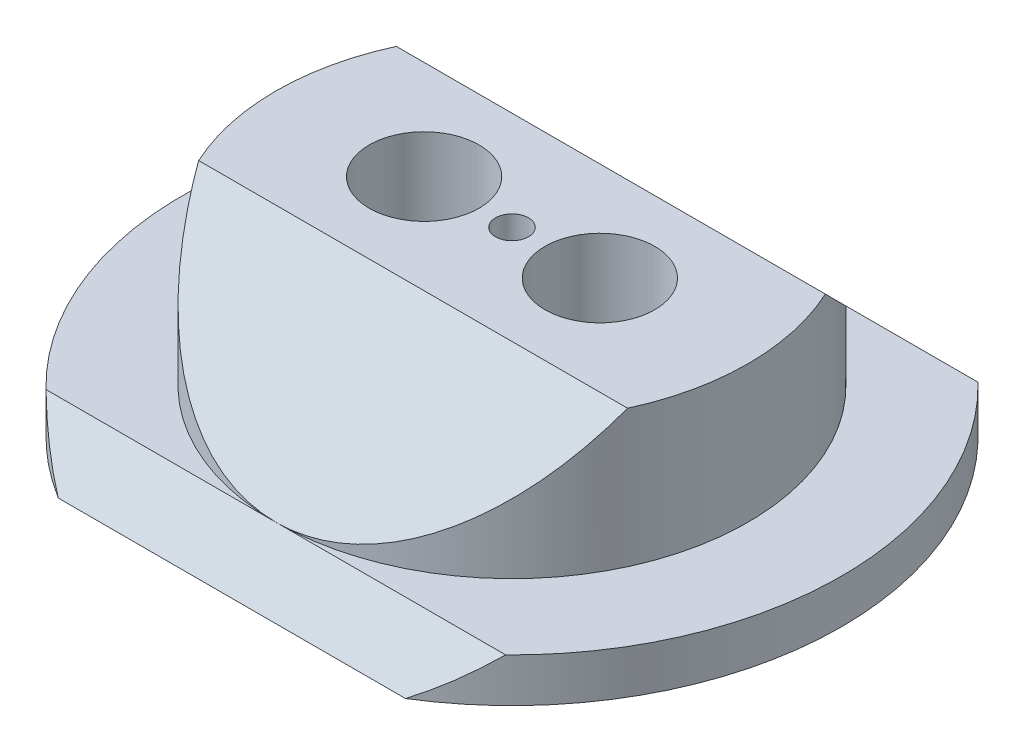
from build123d import *
from build123d.topology import SkipClean

# Parameters (mm, degrees)
SKETCH1_R                            = 30
BOSS_EXTRUDE1_DEPTH                  = 4
BOSS_EXTRUDE2_REACH                  = 44.615
BOSS_EXTRUDE2_END_RADIUS             = 30
BOSS_EXTRUDE2_DIRECTION_2_REACH      = 44.615
BOSS_EXTRUDE2_DIRECTION_2_END_RADIUS = 30
SKETCH3_OUTSIDE_W                    = 78.092
SKETCH3_OUTSIDE_H                    = 69.092
SKETCH3_OUTSIDE_R                    = 21.5
CUT_EXTRUDE2_DEPTH                   = 12.5
BOSS_EXTRUDE3_DEPTH                  = 18
BOSS_EXTRUDE4_DEPTH                  = 15
BOSS_EXTRUDE5_DEPTH                  = 15
CUT_EXTRUDE3_DEPTH                   = 44.292609069
CUT_EXTRUDE3_DEPTH_BACK              = 44.292609069
SKETCH8_R                            = 2
CUT_EXTRUDE8_DEPTH                   = 48.077064479
CUT_EXTRUDE8_DEPTH_BACK              = 48.077064479
CUT_EXTRUDE9_DEPTH                   = 59.659818207
CUT_EXTRUDE11_DEPTH                  = 20
CUT_EXTRUDE12_DEPTH                  = 20
CUT_EXTRUDE13_DEPTH                  = 20
CUT_EXTRUDE14_DEPTH                  = 44.292609069
CUT_EXTRUDE14_DEPTH_BACK             = 44.292609069
SKETCH25_W                           = 66.075437062
SKETCH25_H                           = 20.142243048
SKETCH26_R                           = 5
CUT_EXTRUDE15_DEPTH                  = 24
SKETCH27_R                           = 1.5
CUT_EXTRUDE16_DEPTH                  = 30
SKETCH28_R                           = 5
CUT_EXTRUDE17_DEPTH                  = 3


with BuildPart() as part:
    # Sketch1 → Boss-Extrude1 (new body)
    with BuildSketch(Plane(origin=(0, 0, 0), x_dir=(1, 0, 0), z_dir=(0, 1, 0))):
        with Locations(Location((0, 0, 0), (0, 0, 270))):
            Circle(SKETCH1_R)
    extrude(amount=BOSS_EXTRUDE1_DEPTH)

    # Boss-Extrude2: up to this cylinder (the profile starts inside it)
    with SkipClean():  # the faces are left unmerged after this step: merging them gives an invalid solid
        boss_extrude2_end = Plane(origin=(0, 9.396175, 0), z_dir=(0, -1, 0)) * Cylinder(BOSS_EXTRUDE2_END_RADIUS, 150.23, mode=Mode.PRIVATE)
        # Sketch2 → Boss-Extrude2 (add, up to the surface)
        with BuildSketch(Plane(origin=(0, 0, 0), x_dir=(0, 0, -1), z_dir=(1, 0, 0)), mode=Mode.PRIVATE) as boss_extrude2_sk1:
            Polygon((0, 4), (21.5, 4), (9, 16.5), (-9, 16.5), (-21.5, 4), align=None)
        boss_extrude2_tool1 = extrude(boss_extrude2_sk1.sketch, amount=BOSS_EXTRUDE2_REACH, mode=Mode.PRIVATE) & boss_extrude2_end
        add(boss_extrude2_tool1.solids().sort_by_distance((0, 9.396175, 0))[0])

    # Boss-Extrude2 direction 2: up to this cylinder (the profile starts inside it)
    with SkipClean():  # the faces are left unmerged after this step: merging them gives an invalid solid
        boss_extrude2_direction_2_end = Plane(origin=(0, 9.396175, 0), z_dir=(0, -1, 0)) * Cylinder(BOSS_EXTRUDE2_DIRECTION_2_END_RADIUS, 150.23, mode=Mode.PRIVATE)
        # Sketch2 → Boss-Extrude2 direction 2 (add, up to the surface)
        with BuildSketch(Plane(origin=(0, 0, 0), x_dir=(0, 0, -1), z_dir=(1, 0, 0)), mode=Mode.PRIVATE) as boss_extrude2_direction_2_sk1:
            Polygon((0, 4), (21.5, 4), (9, 16.5), (-9, 16.5), (-21.5, 4), align=None)
        boss_extrude2_direction_2_tool1 = extrude(boss_extrude2_direction_2_sk1.sketch, amount=-BOSS_EXTRUDE2_DIRECTION_2_REACH, mode=Mode.PRIVATE) & boss_extrude2_direction_2_end
        add(boss_extrude2_direction_2_tool1.solids().sort_by_distance((0, 9.396175, 0))[0])

    # SurfaceCut1
    split(bisect_by=Plane(origin=(0, 12.75, -12.75), x_dir=(1, 0, 0), z_dir=(0, 0.7071067811865558, -0.7071067811865392)), keep=Keep.BOTTOM)

    # SurfaceCut2
    split(bisect_by=Plane(origin=(0, 12.75, 12.75), x_dir=(1, 0, 0), z_dir=(0, 0.7071067811865509, 0.7071067811865442)), keep=Keep.BOTTOM)

    # Sketch3 outside → Cut-Extrude2 (cut)
    with SkipClean():  # the faces are left unmerged after this step: merging them gives an invalid solid
        with BuildSketch(Plane(origin=(0, 4, 0), x_dir=(1, 0, 0), z_dir=(0, 1, 0))):
            Rectangle(SKETCH3_OUTSIDE_W, SKETCH3_OUTSIDE_H)
            Circle(SKETCH3_OUTSIDE_R, mode=Mode.SUBTRACT)
        extrude(amount=CUT_EXTRUDE2_DEPTH, mode=Mode.SUBTRACT)

    # Sketch5 → Boss-Extrude3 (add)
    with SkipClean():  # the faces are left unmerged after this step: merging them gives an invalid solid
        with BuildSketch(Plane(origin=(0, 0, 0), x_dir=(-1, 0, 0), z_dir=(0, -1, 0))):
            Polygon((0, -6), (-17.5, -6), (-17.5, 6), (17.5, 6), (17.5, -6), align=None)
        extrude(amount=BOSS_EXTRUDE3_DEPTH)

    # Sketch6 → Boss-Extrude4 (add)
    with SkipClean():  # the faces are left unmerged after this step: merging them gives an invalid solid
        with BuildSketch(Plane.XZ):
            Polygon((0, 15), (7, 15), (7, 6), (-7, 6), (-7, 15), align=None)
        extrude(amount=BOSS_EXTRUDE4_DEPTH)

    # Sketch7 → Boss-Extrude5 (add)
    with SkipClean():  # the faces are left unmerged after this step: merging them gives an invalid solid
        with BuildSketch(Plane.XZ):
            Polygon((0, -15), (7, -15), (7, -6), (-7, -6), (-7, -15), align=None)
        extrude(amount=BOSS_EXTRUDE5_DEPTH)

    # Sketch8 → Cut-Extrude3 (cut, two sides: drawn at the far end of the back side and taken through both)
    with SkipClean():  # the faces are left unmerged after this step: merging them gives an invalid solid
        with BuildSketch(Plane.XY.offset(-CUT_EXTRUDE3_DEPTH_BACK)):
            with Locations((-12.5, -12.5)):
                Circle(SKETCH8_R)
            with Locations((12.5, -12.5)):
                Circle(SKETCH8_R)
        extrude(amount=CUT_EXTRUDE3_DEPTH + CUT_EXTRUDE3_DEPTH_BACK, mode=Mode.SUBTRACT)

    # Sketch16 → Cut-Extrude8 (cut, two sides: drawn at the far end of the back side and taken through both)
    with SkipClean():  # the faces are left unmerged after this step: merging them gives an invalid solid
        with BuildSketch(Plane.XY.offset(6).offset(-CUT_EXTRUDE8_DEPTH_BACK)):
            Polygon((17.5, -18), (17.5, -14.5), (14, -18), align=None)
            Polygon((-17.5, -18), (-14, -18), (-17.5, -14.5), align=None)
        extrude(amount=CUT_EXTRUDE8_DEPTH + CUT_EXTRUDE8_DEPTH_BACK, mode=Mode.SUBTRACT)

    # Sketch17 → Cut-Extrude9 (cut, through all)
    with SkipClean():  # the faces are left unmerged after this step: merging them gives an invalid solid
        with BuildSketch(Plane(origin=(10.365975269, -9.674910251, -8.062425209), x_dir=(-0.3613483622370374, 0.337258471421235, -0.8693009171531012), z_dir=(0.6355070151731325, -0.5931398808282571, -0.49428323402354774))):
            Polygon((-2.372510104, -6.189601271), (7.980636686, -0.706686759), (7.980636686, -10.965829024), align=None)
        extrude(amount=CUT_EXTRUDE9_DEPTH, mode=Mode.SUBTRACT)

    # Sketch19 → Cut-Extrude11 (cut)
    with SkipClean():  # the faces are left unmerged after this step: merging them gives an invalid solid
        with BuildSketch(Plane(origin=(-10.365975269, -9.674910251, -8.062425209), x_dir=(0.3613483622370374, 0.33725847142123494, -0.8693009171531012), z_dir=(0.6355070151731324, 0.5931398808282571, 0.4942832340235476))):
            Polygon((-2.372510104, -6.189601271), (7.980636686, -10.965829024), (7.980636686, -0.706686759), align=None)
        extrude(amount=-CUT_EXTRUDE11_DEPTH, mode=Mode.SUBTRACT)

    # Sketch20 → Cut-Extrude12 (cut)
    with SkipClean():  # the faces are left unmerged after this step: merging them gives an invalid solid
        with BuildSketch(Plane(origin=(-10.365975269, -9.674910251, 8.062425209), x_dir=(-0.3613483622370374, -0.3372584714212349, -0.8693009171531013), z_dir=(0.6355070151731326, 0.593139880828257, -0.49428323402354757))):
            Polygon((2.372510104, -6.189601271), (-7.980636686, -0.706686759), (-7.980636686, -10.965829024), align=None)
        extrude(amount=-CUT_EXTRUDE12_DEPTH, mode=Mode.SUBTRACT)

    # Sketch21 → Cut-Extrude13 (cut)
    with SkipClean():  # the faces are left unmerged after this step: merging them gives an invalid solid
        with BuildSketch(Plane(origin=(10.365975269, -9.674910251, 8.062425209), x_dir=(-0.3613483622370374, 0.3372584714212349, 0.8693009171531013), z_dir=(-0.6355070151731326, 0.593139880828257, -0.49428323402354757))):
            Polygon((-2.372510104, -6.189601271), (7.980636686, -0.706686759), (7.980636686, -10.965829024), align=None)
        extrude(amount=-CUT_EXTRUDE13_DEPTH, mode=Mode.SUBTRACT)

    # Sketch25 → Cut-Extrude14 (cut, two sides: drawn at the far end of the back side and taken through both)
    with SkipClean():  # the faces are left unmerged after this step: merging them gives an invalid solid
        with BuildSketch(Plane.XY.offset(-CUT_EXTRUDE14_DEPTH_BACK)):
            with Locations((0, -10.071121524)):
                Rectangle(SKETCH25_W, SKETCH25_H)
        extrude(amount=CUT_EXTRUDE14_DEPTH + CUT_EXTRUDE14_DEPTH_BACK, mode=Mode.SUBTRACT)

    # Sketch26 → Cut-Extrude15 (cut)
    with SkipClean():  # the faces are left unmerged after this step: merging them gives an invalid solid
        with BuildSketch(Plane(origin=(0, 16.5, 0), x_dir=(1, 0, 0), z_dir=(0, 1, 0))):
            with Locations(Location((-8, 0, 0), (0, 0, 270))):
                Circle(SKETCH26_R)
            with Locations(Location((8, 0, 0), (0, 0, 270))):
                Circle(SKETCH26_R)
        extrude(amount=-CUT_EXTRUDE15_DEPTH, mode=Mode.SUBTRACT)

    # Sketch27 → Cut-Extrude16 (cut)
    with SkipClean():  # the faces are left unmerged after this step: merging them gives an invalid solid
        with BuildSketch(Plane(origin=(0, 16.5, 0), x_dir=(1, 0, 0), z_dir=(0, 1, 0))):
            with Locations(Location((0, 0, 0), (0, 0, 270))):
                Circle(SKETCH27_R)
        extrude(amount=-CUT_EXTRUDE16_DEPTH, mode=Mode.SUBTRACT)

    # Sketch28 → Cut-Extrude17 (cut)
    with SkipClean():  # the faces are left unmerged after this step: merging them gives an invalid solid
        with BuildSketch(Plane.XZ):
            with Locations(Location((0, -15, 0), (0, 0, 270))):
                Circle(SKETCH28_R)
            with Locations(Location((22, 0, 0), (0, 0, 270))):
                Circle(SKETCH28_R)
            with Locations(Location((0, 15, 0), (0, 0, 270))):
                Circle(SKETCH28_R)
            with Locations(Location((-22, 0, 0), (0, 0, 270))):
                Circle(SKETCH28_R)
            with Locations(Location((-14, 12, 0), (0, 0, 270))):
                Circle(SKETCH28_R)
            with Locations(Location((14, 12, 0), (0, 0, 270))):
                Circle(SKETCH28_R)
            with Locations(Location((14, -12, 0), (0, 0, 270))):
                Circle(SKETCH28_R)
            with Locations(Location((-14, -12, 0), (0, 0, 270))):
                Circle(SKETCH28_R)
        extrude(amount=-CUT_EXTRUDE17_DEPTH, mode=Mode.SUBTRACT)


solid = part.part
